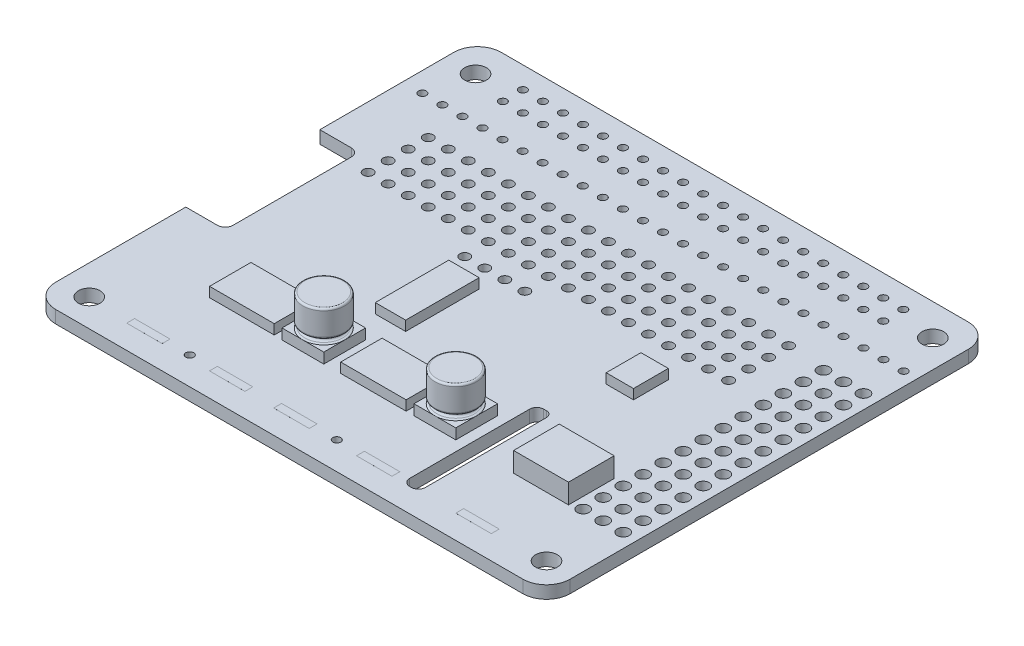
from build123d import *

# Parameters (mm, degrees)
SKETCH1_R                            = 1.375
BOARD_DEPTH                          = 1.6
SKETCH2_R                            = 0.75
SKETCH2_R_2                          = 0.5
SOME_HOLES_DEPTH                     = 1.6
SKETCH2_4_R                          = 0.5
SKETCH2_4_R_2                        = 0.625
REMAINING_HOLES_DEPTH                = 1.6
SKETCH3_W                            = 8.299273158
SKETCH3_H                            = 5.249605127
SKETCH3_W_2                          = 8.201345316
SKETCH3_W_3                          = 3.465572732
SKETCH3_H_2                          = 4.413450555
SKETCH3_W_4                          = 3.853745634
SKETCH3_H_3                          = 9.324821344
ICS_DEPTH                            = 1.25
SKETCH3_5_W                          = 6.963828066
SKETCH3_5_H                          = 5.799690141
VOLTAGE_REGULATOR_DEPTH              = 2.5
SKETCH4_W                            = 5.3
SKETCH4_H                            = 5.3
CAP_BASE_DEPTH                       = 1.32
SKETCH5_R                            = 2.65
CAP1_DEPTH                           = 0.1
SKETCH8_R                            = 2.15
CAP2_DEPTH                           = 0.5
SKETCH9_R                            = 2.65
SKETCH9_R_2                          = 2.15
CAP3_DEPTH                           = 3.38
CAP4_R                               = 0.24
CAP5_R                               = 0.25
CAP6_R                               = 0.25
CAP7_SIZE                            = 0.1
CAP7_SIZE_2                          = 0.25
AUFSATZ_LINEAR_AUSTRAGEN5_DEPTH      = 0.001
AUFSATZ_LINEAR_AUSTRAGEN5_DEPTH_BACK = 1.6
SKIZZE1_W                            = 4.5
SKIZZE1_H                            = 1


# Some blends are built 0.0001 mm under size
with BuildPart() as part:
    # Sketch1 → Board (new body)
    with BuildSketch(Plane(origin=(0, 0, 0), x_dir=(1, 0, 0), z_dir=(0, 1, 0))):
        with BuildLine():
            Line((-12.770378968, 27.403386145), (-72.020378968, 27.403386145))
            ThreePointArc((-72.020378968, 27.403386145), (-74.141699312, 26.524706489), (-75.020378968, 24.403386145))
            Line((-75.020378968, 24.403386145), (-75.020378968, 7.403386145))
            Line((-75.020378968, 7.403386145), (-71.020378968, 7.403386145))
            ThreePointArc((-71.020378968, 7.403386145), (-70.313272187, 7.110492926), (-70.020378968, 6.403386145))
            Line((-70.020378968, 6.403386145), (-70.020378968, -8.596613855))
            ThreePointArc((-70.020378968, -8.596613855), (-70.313272187, -9.303720636), (-71.020378968, -9.596613855))
            Line((-71.020378968, -9.596613855), (-75.020378968, -9.596613855))
            Line((-75.020378968, -9.596613855), (-75.020378968, -26.096613855))
            ThreePointArc((-75.020378968, -26.096613855), (-74.141699312, -28.217934199), (-72.020378968, -29.096613855))
            Line((-72.020378968, -29.096613855), (-12.770378968, -29.096613855))
            ThreePointArc((-12.770378968, -29.096613855), (-10.649058625, -28.217934199), (-9.770378968, -26.096613855))
            Line((-9.770378968, -26.096613855), (-9.770378968, 24.403386145))
            ThreePointArc((-9.770378968, 24.403386145), (-10.649058625, 26.524706489), (-12.770378968, 27.403386145))
        make_face()
        with Locations(Location((-71.270378968, -25.596613855, 0), (0, 0, 270))):
            Circle(SKETCH1_R, mode=Mode.SUBTRACT)
        with BuildLine():
            Line((-30.120378968, -9.096613855), (-29.766856236, -9.096613855))
            ThreePointArc((-29.766856236, -9.096613855), (-29.239017098, -9.315251985), (-29.020378968, -9.843091122))
            Line((-29.020378968, -9.843091122), (-29.020378968, -25.196613855))
            ThreePointArc((-29.020378968, -25.196613855), (-29.283982865, -25.833009958), (-29.920378968, -26.096613855))
            Line((-29.920378968, -26.096613855), (-30.120378968, -26.096613855))
            ThreePointArc((-30.120378968, -26.096613855), (-30.756775072, -25.833009958), (-31.020378968, -25.196613855))
            Line((-31.020378968, -25.196613855), (-31.020378968, -9.996613855))
            ThreePointArc((-31.020378968, -9.996613855), (-30.756775072, -9.360217752), (-30.120378968, -9.096613855))
        make_face(mode=Mode.SUBTRACT)
        with Locations(Location((-13.270378968, -25.596613855, 0), (0, 0, 270))):
            Circle(SKETCH1_R, mode=Mode.SUBTRACT)
        with Locations(Location((-71.270378968, 23.403386145, 0), (0, 0, 270))):
            Circle(SKETCH1_R, mode=Mode.SUBTRACT)
        with Locations(Location((-13.270378968, 23.403386145, 0), (0, 0, 270))):
            Circle(SKETCH1_R, mode=Mode.SUBTRACT)
    extrude(amount=BOARD_DEPTH)

    # Sketch2 → Some Holes (cut)
    with BuildSketch(Plane(origin=(0, 1.6, 0), x_dir=(1, 0, 0), z_dir=(0, 1, 0))):
        with Locations(Location((-11.560378968, -15.036613855, 0), (0, 0, 270))):
            Circle(SKETCH2_R)
        with Locations(Location((-16.640378968, 7.823386145, 0), (0, 0, 270))):
            Circle(SKETCH2_R)
        with Locations(Location((-16.640378968, -17.576613855, 0), (0, 0, 270))):
            Circle(SKETCH2_R)
        with Locations(Location((-14.100378968, -17.576613855, 0), (0, 0, 270))):
            Circle(SKETCH2_R)
        with Locations(Location((-11.560378968, -17.576613855, 0), (0, 0, 270))):
            Circle(SKETCH2_R)
        with Locations(Location((-14.100378968, -15.036613855, 0), (0, 0, 270))):
            Circle(SKETCH2_R)
        with Locations(Location((-16.640378968, -15.036613855, 0), (0, 0, 270))):
            Circle(SKETCH2_R)
        with Locations(Location((-16.640378968, -12.496613855, 0), (0, 0, 270))):
            Circle(SKETCH2_R)
        with Locations(Location((-14.100378968, -12.496613855, 0), (0, 0, 270))):
            Circle(SKETCH2_R)
        with Locations(Location((-11.560378968, -12.496613855, 0), (0, 0, 270))):
            Circle(SKETCH2_R)
        with Locations(Location((-11.560378968, -9.956613855, 0), (0, 0, 270))):
            Circle(SKETCH2_R)
        with Locations(Location((-14.100378968, -9.956613855, 0), (0, 0, 270))):
            Circle(SKETCH2_R)
        with Locations(Location((-16.640378968, -9.956613855, 0), (0, 0, 270))):
            Circle(SKETCH2_R)
        with Locations(Location((-16.640378968, -7.416613855, 0), (0, 0, 270))):
            Circle(SKETCH2_R)
        with Locations(Location((-14.100378968, -7.416613855, 0), (0, 0, 270))):
            Circle(SKETCH2_R)
        with Locations(Location((-11.560378968, -7.416613855, 0), (0, 0, 270))):
            Circle(SKETCH2_R)
        with Locations(Location((-11.560378968, -4.876613855, 0), (0, 0, 270))):
            Circle(SKETCH2_R)
        with Locations(Location((-14.100378968, -4.876613855, 0), (0, 0, 270))):
            Circle(SKETCH2_R)
        with Locations(Location((-16.640378968, -4.876613855, 0), (0, 0, 270))):
            Circle(SKETCH2_R)
        with Locations(Location((-16.640378968, -2.336613855, 0), (0, 0, 270))):
            Circle(SKETCH2_R)
        with Locations(Location((-14.100378968, -2.336613855, 0), (0, 0, 270))):
            Circle(SKETCH2_R)
        with Locations(Location((-11.560378968, -2.336613855, 0), (0, 0, 270))):
            Circle(SKETCH2_R)
        with Locations(Location((-11.560378968, 0.203386145, 0), (0, 0, 270))):
            Circle(SKETCH2_R)
        with Locations(Location((-14.100378968, 0.203386145, 0), (0, 0, 270))):
            Circle(SKETCH2_R)
        with Locations(Location((-16.640378968, 0.203386145, 0), (0, 0, 270))):
            Circle(SKETCH2_R)
        with Locations(Location((-16.640378968, 2.743386145, 0), (0, 0, 270))):
            Circle(SKETCH2_R)
        with Locations(Location((-14.100378968, 2.743386145, 0), (0, 0, 270))):
            Circle(SKETCH2_R)
        with Locations(Location((-11.560378968, 2.743386145, 0), (0, 0, 270))):
            Circle(SKETCH2_R)
        with Locations(Location((-11.560378968, 5.283386145, 0), (0, 0, 270))):
            Circle(SKETCH2_R)
        with Locations(Location((-14.100378968, 5.283386145, 0), (0, 0, 270))):
            Circle(SKETCH2_R)
        with Locations(Location((-16.640378968, 5.283386145, 0), (0, 0, 270))):
            Circle(SKETCH2_R)
        with Locations(Location((-14.100378968, 7.823386145, 0), (0, 0, 270))):
            Circle(SKETCH2_R)
        with Locations(Location((-11.560378968, 7.823386145, 0), (0, 0, 270))):
            Circle(SKETCH2_R)
        with Locations(Location((-11.560378968, 10.363386145, 0), (0, 0, 270))):
            Circle(SKETCH2_R)
        with Locations(Location((-11.560378968, 12.903386145, 0), (0, 0, 270))):
            Circle(SKETCH2_R)
        with Locations(Location((-14.100378968, 10.363386145, 0), (0, 0, 270))):
            Circle(SKETCH2_R)
        with Locations(Location((-16.640378968, 10.363386145, 0), (0, 0, 270))):
            Circle(SKETCH2_R)
        with Locations(Location((-16.640378968, 12.903386145, 0), (0, 0, 270))):
            Circle(SKETCH2_R)
        with Locations(Location((-14.100378968, 12.903386145, 0), (0, 0, 270))):
            Circle(SKETCH2_R)
        with Locations(Location((-11.470378968, 17.903386145, 0), (0, 0, 270))):
            Circle(SKETCH2_R_2)
        with Locations(Location((-14.014128968, 17.903386145, 0), (0, 0, 270))):
            Circle(SKETCH2_R_2)
        with Locations(Location((-16.557878968, 17.903386145, 0), (0, 0, 270))):
            Circle(SKETCH2_R_2)
        with Locations(Location((-19.101628968, 17.903386145, 0), (0, 0, 270))):
            Circle(SKETCH2_R_2)
        with Locations(Location((-21.645378968, 17.903386145, 0), (0, 0, 270))):
            Circle(SKETCH2_R_2)
        with Locations(Location((-18.260378968, 22.113386145, 0), (0, 0, 270))):
            Circle(SKETCH2_R_2)
        with Locations(Location((-18.260378968, 24.653386145, 0), (0, 0, 270))):
            Circle(SKETCH2_R_2)
        with Locations(Location((-20.800378968, 22.113386145, 0), (0, 0, 270))):
            Circle(SKETCH2_R_2)
        with Locations(Location((-20.800378968, 24.653386145, 0), (0, 0, 270))):
            Circle(SKETCH2_R_2)
        with Locations(Location((-23.340378968, 22.113386145, 0), (0, 0, 270))):
            Circle(SKETCH2_R_2)
        with Locations(Location((-23.340378968, 24.653386145, 0), (0, 0, 270))):
            Circle(SKETCH2_R_2)
        with Locations(Location((-24.189128968, 17.903386145, 0), (0, 0, 270))):
            Circle(SKETCH2_R_2)
        with Locations(Location((-26.732878968, 17.903386145, 0), (0, 0, 270))):
            Circle(SKETCH2_R_2)
        with Locations(Location((-25.880378968, 22.113386145, 0), (0, 0, 270))):
            Circle(SKETCH2_R_2)
        with Locations(Location((-25.880378968, 24.653386145, 0), (0, 0, 270))):
            Circle(SKETCH2_R_2)
        with Locations(Location((-28.420378968, 24.653386145, 0), (0, 0, 270))):
            Circle(SKETCH2_R_2)
        with Locations(Location((-28.420378968, 22.113386145, 0), (0, 0, 270))):
            Circle(SKETCH2_R_2)
        with Locations(Location((-29.276628968, 17.903386145, 0), (0, 0, 270))):
            Circle(SKETCH2_R_2)
        with Locations(Location((-31.820378968, 17.903386145, 0), (0, 0, 270))):
            Circle(SKETCH2_R_2)
        with Locations(Location((-30.960378968, 22.113386145, 0), (0, 0, 270))):
            Circle(SKETCH2_R_2)
        with Locations(Location((-30.960378968, 24.653386145, 0), (0, 0, 270))):
            Circle(SKETCH2_R_2)
        with Locations(Location((-34.364128968, 17.903386145, 0), (0, 0, 270))):
            Circle(SKETCH2_R_2)
        with Locations(Location((-33.500378968, 22.113386145, 0), (0, 0, 270))):
            Circle(SKETCH2_R_2)
        with Locations(Location((-33.500378968, 24.653386145, 0), (0, 0, 270))):
            Circle(SKETCH2_R_2)
        with Locations(Location((-36.907878968, 17.903386145, 0), (0, 0, 270))):
            Circle(SKETCH2_R_2)
        with Locations(Location((-36.040378968, 22.113386145, 0), (0, 0, 270))):
            Circle(SKETCH2_R_2)
        with Locations(Location((-36.040378968, 24.653386145, 0), (0, 0, 270))):
            Circle(SKETCH2_R_2)
        with Locations(Location((-39.451628968, 17.903386145, 0), (0, 0, 270))):
            Circle(SKETCH2_R_2)
        with Locations(Location((-38.580378968, 22.113386145, 0), (0, 0, 270))):
            Circle(SKETCH2_R_2)
        with Locations(Location((-38.580378968, 24.653386145, 0), (0, 0, 270))):
            Circle(SKETCH2_R_2)
        with Locations(Location((-41.995378968, 17.903386145, 0), (0, 0, 270))):
            Circle(SKETCH2_R_2)
        with Locations(Location((-41.120378968, 22.113386145, 0), (0, 0, 270))):
            Circle(SKETCH2_R_2)
        with Locations(Location((-41.120378968, 24.653386145, 0), (0, 0, 270))):
            Circle(SKETCH2_R_2)
        with Locations(Location((-44.539128968, 17.903386145, 0), (0, 0, 270))):
            Circle(SKETCH2_R_2)
        with Locations(Location((-43.660378968, 22.113386145, 0), (0, 0, 270))):
            Circle(SKETCH2_R_2)
        with Locations(Location((-43.660378968, 24.653386145, 0), (0, 0, 270))):
            Circle(SKETCH2_R_2)
        with Locations(Location((-46.200378968, 24.653386145, 0), (0, 0, 270))):
            Circle(SKETCH2_R_2)
        with Locations(Location((-46.200378968, 22.113386145, 0), (0, 0, 270))):
            Circle(SKETCH2_R_2)
        with Locations(Location((-47.082878968, 17.903386145, 0), (0, 0, 270))):
            Circle(SKETCH2_R_2)
        with Locations(Location((-49.626628968, 17.903386145, 0), (0, 0, 270))):
            Circle(SKETCH2_R_2)
        with Locations(Location((-48.740378968, 22.113386145, 0), (0, 0, 270))):
            Circle(SKETCH2_R_2)
        with Locations(Location((-48.740378968, 24.653386145, 0), (0, 0, 270))):
            Circle(SKETCH2_R_2)
        with Locations(Location((-51.280378968, 24.653386145, 0), (0, 0, 270))):
            Circle(SKETCH2_R_2)
        with Locations(Location((-51.280378968, 22.113386145, 0), (0, 0, 270))):
            Circle(SKETCH2_R_2)
        with Locations(Location((-52.170378968, 17.903386145, 0), (0, 0, 270))):
            Circle(SKETCH2_R_2)
        with Locations(Location((-54.714128968, 17.903386145, 0), (0, 0, 270))):
            Circle(SKETCH2_R_2)
        with Locations(Location((-53.820378968, 22.113386145, 0), (0, 0, 270))):
            Circle(SKETCH2_R_2)
        with Locations(Location((-53.820378968, 24.653386145, 0), (0, 0, 270))):
            Circle(SKETCH2_R_2)
        with Locations(Location((-56.360378968, 24.653386145, 0), (0, 0, 270))):
            Circle(SKETCH2_R_2)
        with Locations(Location((-56.360378968, 22.113386145, 0), (0, 0, 270))):
            Circle(SKETCH2_R_2)
        with Locations(Location((-57.257878968, 17.903386145, 0), (0, 0, 270))):
            Circle(SKETCH2_R_2)
        with Locations(Location((-59.801628968, 17.903386145, 0), (0, 0, 270))):
            Circle(SKETCH2_R_2)
        with Locations(Location((-58.900378968, 22.113386145, 0), (0, 0, 270))):
            Circle(SKETCH2_R_2)
        with Locations(Location((-58.900378968, 24.653386145, 0), (0, 0, 270))):
            Circle(SKETCH2_R_2)
        with Locations(Location((-61.440378968, 24.653386145, 0), (0, 0, 270))):
            Circle(SKETCH2_R_2)
        with Locations(Location((-61.440378968, 22.113386145, 0), (0, 0, 270))):
            Circle(SKETCH2_R_2)
        with Locations(Location((-62.345378968, 17.903386145, 0), (0, 0, 270))):
            Circle(SKETCH2_R_2)
        with Locations(Location((-64.889128968, 17.903386145, 0), (0, 0, 270))):
            Circle(SKETCH2_R_2)
        with Locations(Location((-63.980378968, 22.113386145, 0), (0, 0, 270))):
            Circle(SKETCH2_R_2)
        with Locations(Location((-63.980378968, 24.653386145, 0), (0, 0, 270))):
            Circle(SKETCH2_R_2)
        with Locations(Location((-66.520378968, 24.653386145, 0), (0, 0, 270))):
            Circle(SKETCH2_R_2)
    extrude(amount=-SOME_HOLES_DEPTH, mode=Mode.SUBTRACT)

    # Sketch2<4> → Remaining Holes (cut)
    with BuildSketch(Plane(origin=(0, 1.6, 0), x_dir=(1, 0, 0), z_dir=(0, 1, 0))):
        with Locations(Location((-66.520378968, 22.113386145, 0), (0, 0, 270))):
            Circle(SKETCH2_4_R)
        with Locations(Location((-72.520378968, 17.903386145, 0), (0, 0, 270))):
            Circle(SKETCH2_4_R)
        with Locations(Location((-69.976628968, 17.903386145, 0), (0, 0, 270))):
            Circle(SKETCH2_4_R)
        with Locations(Location((-67.432878968, 17.903386145, 0), (0, 0, 270))):
            Circle(SKETCH2_4_R)
        with Locations(Location((-67.270378968, 13.403386145, 0), (0, 0, 270))):
            Circle(SKETCH2_4_R_2)
        with Locations(Location((-64.730378968, 13.403386145, 0), (0, 0, 270))):
            Circle(SKETCH2_4_R_2)
        with Locations(Location((-62.190378968, 13.403386145, 0), (0, 0, 270))):
            Circle(SKETCH2_4_R_2)
        with Locations(Location((-59.650378968, 13.403386145, 0), (0, 0, 270))):
            Circle(SKETCH2_4_R_2)
        with Locations(Location((-57.110378968, 13.403386145, 0), (0, 0, 270))):
            Circle(SKETCH2_4_R_2)
        with Locations(Location((-54.570378968, 13.403386145, 0), (0, 0, 270))):
            Circle(SKETCH2_4_R_2)
        with Locations(Location((-52.030378968, 13.403386145, 0), (0, 0, 270))):
            Circle(SKETCH2_4_R_2)
        with Locations(Location((-49.490378968, 13.403386145, 0), (0, 0, 270))):
            Circle(SKETCH2_4_R_2)
        with Locations(Location((-46.950378968, 13.403386145, 0), (0, 0, 270))):
            Circle(SKETCH2_4_R_2)
        with Locations(Location((-44.410378968, 13.403386145, 0), (0, 0, 270))):
            Circle(SKETCH2_4_R_2)
        with Locations(Location((-41.870378968, 13.403386145, 0), (0, 0, 270))):
            Circle(SKETCH2_4_R_2)
        with Locations(Location((-39.330378968, 13.403386145, 0), (0, 0, 270))):
            Circle(SKETCH2_4_R_2)
        with Locations(Location((-36.790378968, 13.403386145, 0), (0, 0, 270))):
            Circle(SKETCH2_4_R_2)
        with Locations(Location((-34.250378968, 13.403386145, 0), (0, 0, 270))):
            Circle(SKETCH2_4_R_2)
        with Locations(Location((-31.710378968, 13.403386145, 0), (0, 0, 270))):
            Circle(SKETCH2_4_R_2)
        with Locations(Location((-29.170378968, 13.403386145, 0), (0, 0, 270))):
            Circle(SKETCH2_4_R_2)
        with Locations(Location((-26.630378968, 13.403386145, 0), (0, 0, 270))):
            Circle(SKETCH2_4_R_2)
        with Locations(Location((-24.090378968, 13.403386145, 0), (0, 0, 270))):
            Circle(SKETCH2_4_R_2)
        with Locations(Location((-21.550378968, 13.403386145, 0), (0, 0, 270))):
            Circle(SKETCH2_4_R_2)
        with Locations(Location((-64.730378968, 10.863386145, 0), (0, 0, 270))):
            Circle(SKETCH2_4_R_2)
        with Locations(Location((-62.190378968, 10.863386145, 0), (0, 0, 270))):
            Circle(SKETCH2_4_R_2)
        with Locations(Location((-59.650378968, 10.863386145, 0), (0, 0, 270))):
            Circle(SKETCH2_4_R_2)
        with Locations(Location((-57.110378968, 10.863386145, 0), (0, 0, 270))):
            Circle(SKETCH2_4_R_2)
        with Locations(Location((-54.570378968, 10.863386145, 0), (0, 0, 270))):
            Circle(SKETCH2_4_R_2)
        with Locations(Location((-52.030378968, 10.863386145, 0), (0, 0, 270))):
            Circle(SKETCH2_4_R_2)
        with Locations(Location((-49.490378968, 10.863386145, 0), (0, 0, 270))):
            Circle(SKETCH2_4_R_2)
        with Locations(Location((-46.950378968, 10.863386145, 0), (0, 0, 270))):
            Circle(SKETCH2_4_R_2)
        with Locations(Location((-44.410378968, 10.863386145, 0), (0, 0, 270))):
            Circle(SKETCH2_4_R_2)
        with Locations(Location((-41.870378968, 10.863386145, 0), (0, 0, 270))):
            Circle(SKETCH2_4_R_2)
        with Locations(Location((-39.330378968, 10.863386145, 0), (0, 0, 270))):
            Circle(SKETCH2_4_R_2)
        with Locations(Location((-36.790378968, 10.863386145, 0), (0, 0, 270))):
            Circle(SKETCH2_4_R_2)
        with Locations(Location((-34.250378968, 10.863386145, 0), (0, 0, 270))):
            Circle(SKETCH2_4_R_2)
        with Locations(Location((-31.710378968, 10.863386145, 0), (0, 0, 270))):
            Circle(SKETCH2_4_R_2)
        with Locations(Location((-29.170378968, 10.863386145, 0), (0, 0, 270))):
            Circle(SKETCH2_4_R_2)
        with Locations(Location((-26.630378968, 10.863386145, 0), (0, 0, 270))):
            Circle(SKETCH2_4_R_2)
        with Locations(Location((-24.090378968, 10.863386145, 0), (0, 0, 270))):
            Circle(SKETCH2_4_R_2)
        with Locations(Location((-21.550378968, 10.863386145, 0), (0, 0, 270))):
            Circle(SKETCH2_4_R_2)
        with Locations(Location((-64.730378968, 8.323386145, 0), (0, 0, 270))):
            Circle(SKETCH2_4_R_2)
        with Locations(Location((-62.190378968, 8.323386145, 0), (0, 0, 270))):
            Circle(SKETCH2_4_R_2)
        with Locations(Location((-59.650378968, 8.323386145, 0), (0, 0, 270))):
            Circle(SKETCH2_4_R_2)
        with Locations(Location((-57.110378968, 8.323386145, 0), (0, 0, 270))):
            Circle(SKETCH2_4_R_2)
        with Locations(Location((-54.570378968, 8.323386145, 0), (0, 0, 270))):
            Circle(SKETCH2_4_R_2)
        with Locations(Location((-52.030378968, 8.323386145, 0), (0, 0, 270))):
            Circle(SKETCH2_4_R_2)
        with Locations(Location((-49.490378968, 8.323386145, 0), (0, 0, 270))):
            Circle(SKETCH2_4_R_2)
        with Locations(Location((-46.950378968, 8.323386145, 0), (0, 0, 270))):
            Circle(SKETCH2_4_R_2)
        with Locations(Location((-44.410378968, 8.323386145, 0), (0, 0, 270))):
            Circle(SKETCH2_4_R_2)
        with Locations(Location((-41.870378968, 8.323386145, 0), (0, 0, 270))):
            Circle(SKETCH2_4_R_2)
        with Locations(Location((-39.330378968, 8.323386145, 0), (0, 0, 270))):
            Circle(SKETCH2_4_R_2)
        with Locations(Location((-36.790378968, 8.323386145, 0), (0, 0, 270))):
            Circle(SKETCH2_4_R_2)
        with Locations(Location((-34.250378968, 8.323386145, 0), (0, 0, 270))):
            Circle(SKETCH2_4_R_2)
        with Locations(Location((-31.710378968, 8.323386145, 0), (0, 0, 270))):
            Circle(SKETCH2_4_R_2)
        with Locations(Location((-29.170378968, 8.323386145, 0), (0, 0, 270))):
            Circle(SKETCH2_4_R_2)
        with Locations(Location((-26.630378968, 8.323386145, 0), (0, 0, 270))):
            Circle(SKETCH2_4_R_2)
        with Locations(Location((-24.090378968, 8.323386145, 0), (0, 0, 270))):
            Circle(SKETCH2_4_R_2)
        with Locations(Location((-21.550378968, 8.323386145, 0), (0, 0, 270))):
            Circle(SKETCH2_4_R_2)
        with Locations(Location((-64.730378968, 5.783386145, 0), (0, 0, 270))):
            Circle(SKETCH2_4_R_2)
        with Locations(Location((-62.190378968, 5.783386145, 0), (0, 0, 270))):
            Circle(SKETCH2_4_R_2)
        with Locations(Location((-59.650378968, 5.783386145, 0), (0, 0, 270))):
            Circle(SKETCH2_4_R_2)
        with Locations(Location((-57.110378968, 5.783386145, 0), (0, 0, 270))):
            Circle(SKETCH2_4_R_2)
        with Locations(Location((-54.570378968, 5.783386145, 0), (0, 0, 270))):
            Circle(SKETCH2_4_R_2)
        with Locations(Location((-52.030378968, 5.783386145, 0), (0, 0, 270))):
            Circle(SKETCH2_4_R_2)
        with Locations(Location((-49.490378968, 5.783386145, 0), (0, 0, 270))):
            Circle(SKETCH2_4_R_2)
        with Locations(Location((-46.950378968, 5.783386145, 0), (0, 0, 270))):
            Circle(SKETCH2_4_R_2)
        with Locations(Location((-44.410378968, 5.783386145, 0), (0, 0, 270))):
            Circle(SKETCH2_4_R_2)
        with Locations(Location((-41.870378968, 5.783386145, 0), (0, 0, 270))):
            Circle(SKETCH2_4_R_2)
        with Locations(Location((-39.330378968, 5.783386145, 0), (0, 0, 270))):
            Circle(SKETCH2_4_R_2)
        with Locations(Location((-36.790378968, 5.783386145, 0), (0, 0, 270))):
            Circle(SKETCH2_4_R_2)
        with Locations(Location((-34.250378968, 5.783386145, 0), (0, 0, 270))):
            Circle(SKETCH2_4_R_2)
        with Locations(Location((-31.710378968, 5.783386145, 0), (0, 0, 270))):
            Circle(SKETCH2_4_R_2)
        with Locations(Location((-29.170378968, 5.783386145, 0), (0, 0, 270))):
            Circle(SKETCH2_4_R_2)
        with Locations(Location((-26.630378968, 5.783386145, 0), (0, 0, 270))):
            Circle(SKETCH2_4_R_2)
        with Locations(Location((-24.090378968, 5.783386145, 0), (0, 0, 270))):
            Circle(SKETCH2_4_R_2)
        with Locations(Location((-21.550378968, 5.783386145, 0), (0, 0, 270))):
            Circle(SKETCH2_4_R_2)
        with Locations(Location((-67.270378968, 10.863386145, 0), (0, 0, 270))):
            Circle(SKETCH2_4_R_2)
        with Locations(Location((-67.270378968, 8.323386145, 0), (0, 0, 270))):
            Circle(SKETCH2_4_R_2)
        with Locations(Location((-67.270378968, 5.783386145, 0), (0, 0, 270))):
            Circle(SKETCH2_4_R_2)
        with Locations(Location((-44.270378968, 2.653386145, 0), (0, 0, 270))):
            Circle(SKETCH2_4_R_2)
        with Locations(Location((-46.810378968, 2.653386145, 0), (0, 0, 270))):
            Circle(SKETCH2_4_R_2)
        with Locations(Location((-49.350378968, 2.653386145, 0), (0, 0, 270))):
            Circle(SKETCH2_4_R_2)
        with Locations(Location((-51.890378968, 2.653386145, 0), (0, 0, 270))):
            Circle(SKETCH2_4_R_2)
        with Locations(Location((-20.270378968, -25.596613855, 0), (0, 0, 270))):
            Circle(SKETCH2_4_R)
        with Locations(Location((-23.770378968, -25.596613855, 0), (0, 0, 270))):
            Circle(SKETCH2_4_R)
        with Locations(Location((-32.870378968, -25.596613855, 0), (0, 0, 270))):
            Circle(SKETCH2_4_R)
        with Locations(Location((-36.370378968, -25.596613855, 0), (0, 0, 270))):
            Circle(SKETCH2_4_R)
        with Locations(Location((-39.870378968, -25.596613855, 0), (0, 0, 270))):
            Circle(SKETCH2_4_R)
        with Locations(Location((-43.370378968, -25.596613855, 0), (0, 0, 270))):
            Circle(SKETCH2_4_R)
        with Locations(Location((-46.870378968, -25.596613855, 0), (0, 0, 270))):
            Circle(SKETCH2_4_R)
        with Locations(Location((-65.520378968, -25.596613855, 0), (0, 0, 270))):
            Circle(SKETCH2_4_R)
        with Locations(Location((-62.020378968, -25.596613855, 0), (0, 0, 270))):
            Circle(SKETCH2_4_R)
        with Locations(Location((-58.520378968, -25.596613855, 0), (0, 0, 270))):
            Circle(SKETCH2_4_R)
        with Locations(Location((-55.020378968, -25.596613855, 0), (0, 0, 270))):
            Circle(SKETCH2_4_R)
        with Locations(Location((-51.520378968, -25.596613855, 0), (0, 0, 270))):
            Circle(SKETCH2_4_R)
    extrude(amount=-REMAINING_HOLES_DEPTH, mode=Mode.SUBTRACT)

    # Sketch3 → ICs (add)
    with BuildSketch(Plane(origin=(0, 1.6, 0), x_dir=(1, 0, 0), z_dir=(0, 1, 0))):
        with Locations((-42.773872867, -15.424180304)):
            Rectangle(SKETCH3_W, SKETCH3_H)
        with Locations((-59.455950908, -15.424180304)):
            Rectangle(SKETCH3_W_2, SKETCH3_H)
        with Locations((-27.176884672, -0.18103568)):
            Rectangle(SKETCH3_W_3, SKETCH3_H_2)
        with Locations((-49.336031492, -4.662410672)):
            Rectangle(SKETCH3_W_4, SKETCH3_H_3)
    extrude(amount=ICS_DEPTH)

    # Sketch3<5> → Voltage Regulator (add)
    with BuildSketch(Plane(origin=(0, 1.6, 0), x_dir=(1, 0, 0), z_dir=(0, 1, 0))):
        with Locations((-21.512408584, -15.149137796)):
            Rectangle(SKETCH3_5_W, SKETCH3_5_H)
    extrude(amount=VOLTAGE_REGULATOR_DEPTH)

    # Sketch4 → Cap Base (add)
    with BuildSketch(Plane(origin=(0, 1.6, 0), x_dir=(1, 0, 0), z_dir=(0, 1, 0))):
        with Locations((-51.670378968, -15.446613855)):
            Rectangle(SKETCH4_W, SKETCH4_H)
        with Locations((-34.970378968, -15.404370659)):
            Rectangle(SKETCH4_W, SKETCH4_H)
    extrude(amount=CAP_BASE_DEPTH)

    # Sketch5 → Cap1 (add)
    with BuildSketch(Plane(origin=(0, 2.92, 0), x_dir=(1, 0, 0), z_dir=(0, 1, 0))):
        with Locations(Location((-51.670378968, -15.446613855, 0), (0, 0, 270))):
            Circle(SKETCH5_R)
        with Locations(Location((-34.970378968, -15.404370659, 0), (0, 0, 270))):
            Circle(SKETCH5_R)
    extrude(amount=CAP1_DEPTH)

    # Sketch8 → Cap2 (add)
    with BuildSketch(Plane(origin=(0, 3.02, 0), x_dir=(1, 0, 0), z_dir=(0, 1, 0))):
        with Locations(Location((-34.970378968, -15.404370659, 0), (0, 0, 270))):
            Circle(SKETCH8_R)
        with Locations(Location((-51.670378968, -15.446613855, 0), (0, 0, 270))):
            Circle(SKETCH8_R)
    extrude(amount=CAP2_DEPTH)

    # Sketch9 → Cap3 (add)
    # profile 1 of 4: a face of its own
    with BuildSketch(Plane(origin=(0, 3.52, 0), x_dir=(1, 0, 0), z_dir=(0, 1, 0))):
        with Locations(Location((-51.670378968, -15.446613855, 0), (0, 0, 270))):
            Circle(SKETCH9_R)
        with Locations(Location((-51.670378968, -15.446613855, 0), (0, 0, 270))):
            Circle(SKETCH9_R_2, mode=Mode.SUBTRACT)
    # profile 2 of 4: a face of its own
    with BuildSketch(Plane(origin=(0, 3.52, 0), x_dir=(1, 0, 0), z_dir=(0, 1, 0))):
        with Locations(Location((-51.670378968, -15.446613855, 0), (0, 0, 270))):
            Circle(SKETCH9_R_2)
    # profile 3 of 4: a face of its own
    with BuildSketch(Plane(origin=(0, 3.52, 0), x_dir=(1, 0, 0), z_dir=(0, 1, 0))):
        with Locations(Location((-34.970378968, -15.404370659, 0), (0, 0, 270))):
            Circle(SKETCH9_R)
        with Locations(Location((-34.970378968, -15.404370659, 0), (0, 0, 270))):
            Circle(SKETCH9_R_2, mode=Mode.SUBTRACT)
    # profile 4 of 4: a face of its own
    with BuildSketch(Plane(origin=(0, 3.52, 0), x_dir=(1, 0, 0), z_dir=(0, 1, 0))):
        with Locations(Location((-34.970378968, -15.404370659, 0), (0, 0, 270))):
            Circle(SKETCH9_R_2)
    extrude(amount=CAP3_DEPTH)

    # Cap4
    cap4_edges = [part.edges().sort_by_distance(p)[0] for p in [
        (-51.670378968, 6.9, 12.796613855),
        (-34.970378968, 6.9, 12.754370659),
    ]]
    fillet(cap4_edges, radius=CAP4_R)

    # Cap5
    cap5_edges = [part.edges().sort_by_distance(p)[0] for p in [
        (-34.970378968, 3.02, 13.254370659),
        (-34.970378968, 3.52, 13.254370659),
        (-51.670378968, 3.02, 13.296613855),
        (-51.670378968, 3.52, 13.296613855),
    ]]
    fillet(cap5_edges, radius=CAP5_R - 0.0001)  # a hair under: the kernel refuses the full size

    # Cap6
    cap6_edges = [part.edges().sort_by_distance(p)[0] for p in [
        (-51.670378968, 3.52, 12.796613855),
        (-34.970378968, 3.52, 12.754370659),
    ]]
    fillet(cap6_edges, radius=CAP6_R)

    # Cap7
    # an asymmetric fillet: 0.25, 0.1 mm, written as the material it takes off along each edge
    with BuildSketch(Plane(origin=(-51.670378968, 3.02, 15.446613855), x_dir=(0, 0, 1), z_dir=(-1, 0, 0))) as cap7_piece_1:
        with BuildLine():
            Bezier((2.65, -CAP7_SIZE), (2.65, 0), (2.65 - CAP7_SIZE_2, 0), weights=[1, 0.707106781, 1])
            Line((2.65 - CAP7_SIZE_2, 0), (2.65, 0))
            Line((2.65, 0), (2.65, -CAP7_SIZE))
        make_face()
    revolve(axis=Axis((-51.670378968, 3.02, 15.446613855), (0, 1, 0)), mode=Mode.SUBTRACT)
    with BuildSketch(Plane(origin=(-34.970378968, 3.02, 15.404370659), x_dir=(0, 0, 1), z_dir=(-1, 0, 0))) as cap7_piece_2:
        with BuildLine():
            Bezier((2.65 - CAP7_SIZE_2, 0), (2.65, 0), (2.65, -CAP7_SIZE), weights=[1, 0.707106781, 1])
            Line((2.65, -CAP7_SIZE), (2.65, 0))
            Line((2.65, 0), (2.65 - CAP7_SIZE_2, 0))
        make_face()
    revolve(axis=Axis((-34.970378968, 3.02, 15.404370659), (0, 1, 0)), mode=Mode.SUBTRACT)

    # Skizze1 → Aufsatz-Linear austragen5 (add, two sides: drawn at the far end of the back side and taken through both)
    with BuildSketch(Plane(origin=(0, 1.6, 0), x_dir=(1, 0, 0), z_dir=(0, 1, 0)).offset(-AUFSATZ_LINEAR_AUSTRAGEN5_DEPTH_BACK)):
        with Locations((-22.020378968, -25.596613855)):
            Rectangle(SKIZZE1_W, SKIZZE1_H)
        with Locations((-45.120378968, -25.596613855)):
            Rectangle(SKIZZE1_W, SKIZZE1_H)
        with Locations((-34.620378968, -25.596613855)):
            Rectangle(SKIZZE1_W, SKIZZE1_H)
        with Locations((-53.270378968, -25.596613855)):
            Rectangle(SKIZZE1_W, SKIZZE1_H)
        with Locations((-63.770378968, -25.596613855)):
            Rectangle(SKIZZE1_W, SKIZZE1_H)
    extrude(amount=AUFSATZ_LINEAR_AUSTRAGEN5_DEPTH + AUFSATZ_LINEAR_AUSTRAGEN5_DEPTH_BACK)


solid = part.part
